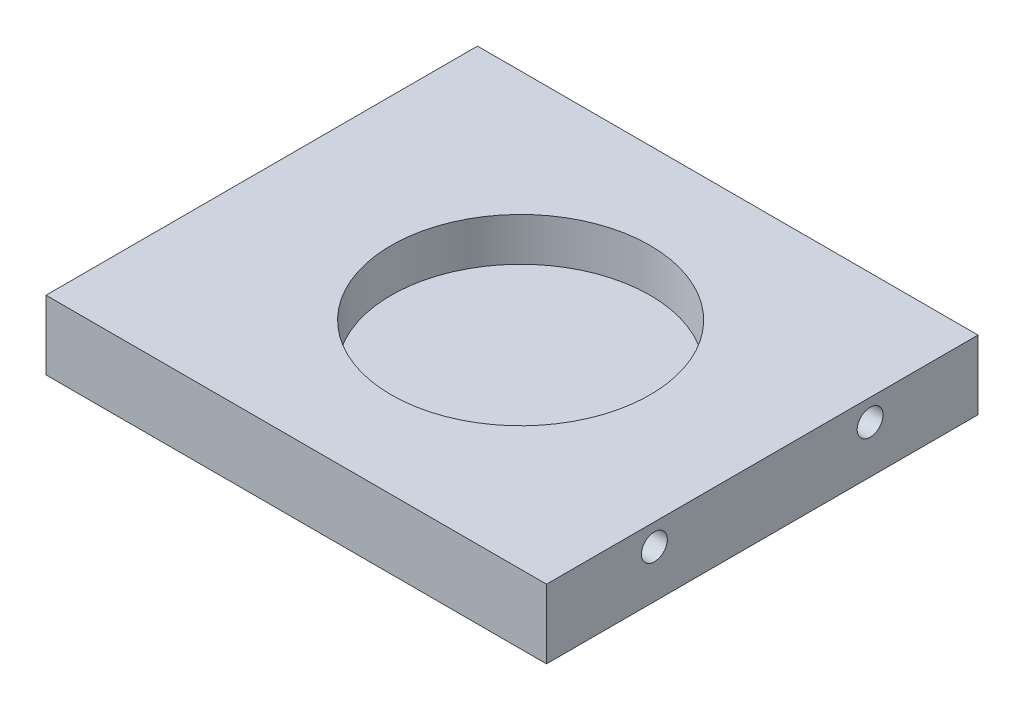
from build123d import *

# Parameters (mm, degrees)
ESQUISSE1_W             = 58
ESQUISSE1_H             = 8
BOSS_EXTRU_1_DEPTH      = 50
ESQUISSE2_R             = 15
ENL_V_MAT_EXTRU_1_DEPTH = 5
ESQUISSE3_R             = 1.5
ENL_V_MAT_EXTRU_2_DEPTH = 10
ENL_V_START             = -10
ESQUISSE4_R             = 1.5
ENL_V_MAT_EXTRU_3_DEPTH = 10


with BuildPart() as part:
    # Esquisse1 → Boss.-Extru.1 (new body)
    with BuildSketch(Plane.XY):
        with Locations((23.5, -49)):
            Rectangle(ESQUISSE1_W, ESQUISSE1_H)
    extrude(amount=BOSS_EXTRU_1_DEPTH)

    # Esquisse2 → Enlèv. mat.-Extru.1 (cut)
    with BuildSketch(Plane(origin=(0, -45, 0), x_dir=(-1, 0, 0), z_dir=(0, 1, 0))):
        with Locations((-24.5, 25)):
            Circle(ESQUISSE2_R)
    extrude(amount=-ENL_V_MAT_EXTRU_1_DEPTH, mode=Mode.SUBTRACT)

    # Esquisse3 → Enlèv. mat.-Extru.2 (cut)
    with BuildSketch(Plane.ZY.offset(5.5)):
        with Locations((12.5, -47.5)):
            Circle(ESQUISSE3_R)
        with Locations((37.5, -47.5)):
            Circle(ESQUISSE3_R)
    extrude(amount=-ENL_V_MAT_EXTRU_2_DEPTH, mode=Mode.SUBTRACT)

    # Esquisse4 → Enlèv. mat.-Extru.3 (cut)
    with BuildSketch(Plane(origin=(52.5, 0, 0), x_dir=(0, 0, -1), z_dir=(1, 0, 0)).offset(ENL_V_START)):
        with Locations((-37.5, -47.5)):
            Circle(ESQUISSE4_R)
        with Locations((-12.5, -47.5)):
            Circle(ESQUISSE4_R)
    extrude(amount=ENL_V_MAT_EXTRU_3_DEPTH, mode=Mode.SUBTRACT)


solid = part.part
